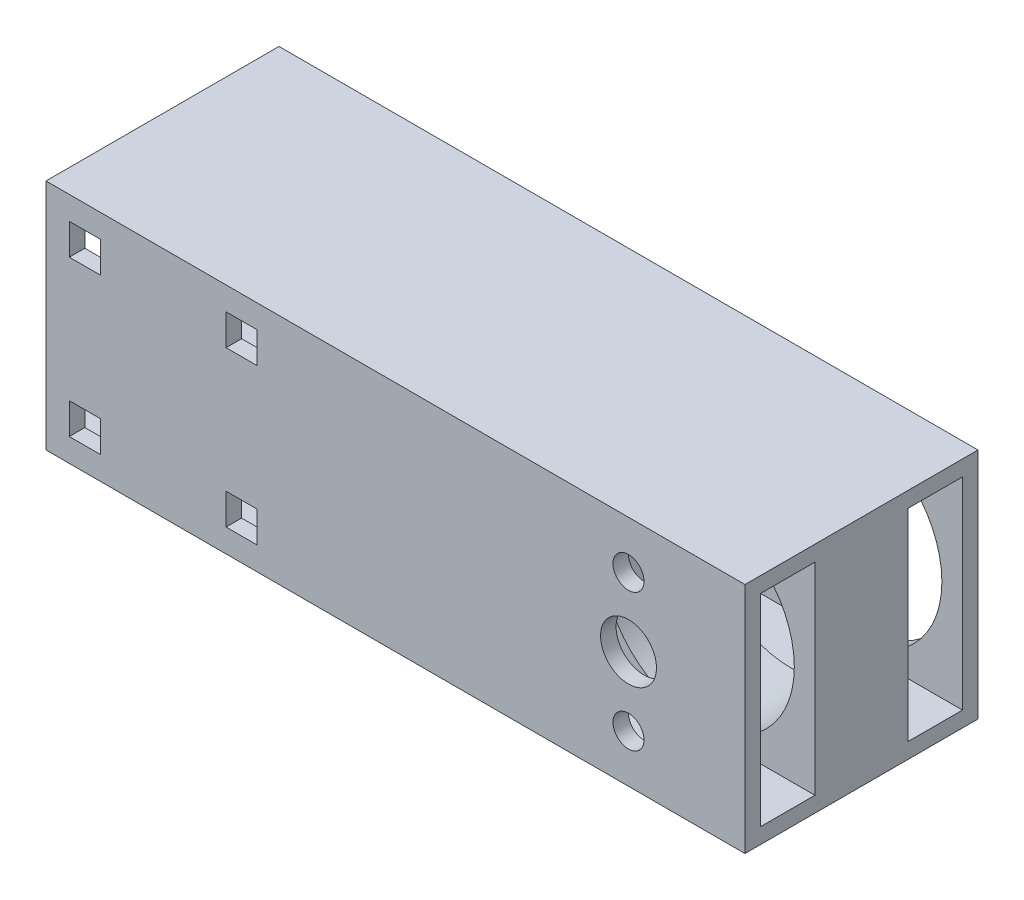
from build123d import *

# Parameters (mm, degrees)
SKETCH1_W           = 30
SKETCH1_H           = 30
SKETCH1_W_2         = 7
SKETCH1_H_2         = 26
BOSS_EXTRUDE3_DEPTH = 90
SKETCH6_R           = 12.35
CUT_EXTRUDE5_DEPTH  = 23
SKETCH8_R           = 3.6
SKETCH8_R_2         = 2
CUT_EXTRUDE6_DEPTH  = 17
SKETCH9_W           = 12
SKETCH9_H           = 26
CUT_EXTRUDE7_DEPTH  = 59
SKETCH10_W          = 4
SKETCH10_H          = 4
CUT_EXTRUDE8_DEPTH  = 34


with BuildPart() as part:
    # Sketch1 → Boss-Extrude3 (new body)
    with BuildSketch(Plane(origin=(0, 0, 0), x_dir=(0, 0, -1), z_dir=(1, 0, 0))):
        Rectangle(SKETCH1_W, SKETCH1_H)
        with Locations((-9.5, 0)):
            Rectangle(SKETCH1_W_2, SKETCH1_H_2, mode=Mode.SUBTRACT)
        with Locations((9.5, 0)):
            Rectangle(SKETCH1_W_2, SKETCH1_H_2, mode=Mode.SUBTRACT)
    extrude(amount=BOSS_EXTRUDE3_DEPTH)

    # Sketch6 → Cut-Extrude5 (cut)
    with BuildSketch(Plane(origin=(0, 0, -15), x_dir=(-1, 0, 0), z_dir=(0, 0, -1))):
        with Locations((-75, 0)):
            Circle(SKETCH6_R)
    extrude(amount=-CUT_EXTRUDE5_DEPTH, mode=Mode.SUBTRACT)

    # Sketch8 → Cut-Extrude6 (cut)
    with BuildSketch(Plane.XY.offset(15)):
        with Locations((75, 0)):
            Circle(SKETCH8_R)
        with Locations((75, 8.85)):
            Circle(SKETCH8_R_2)
        with Locations((75, -8.85)):
            Circle(SKETCH8_R_2)
    extrude(amount=-CUT_EXTRUDE6_DEPTH, mode=Mode.SUBTRACT)

    # Sketch9 → Cut-Extrude7 (cut)
    with BuildSketch(Plane.ZY):
        Rectangle(SKETCH9_W, SKETCH9_H)
    extrude(amount=-CUT_EXTRUDE7_DEPTH, mode=Mode.SUBTRACT)

    # Sketch10 → Cut-Extrude8 (cut)
    with BuildSketch(Plane(origin=(0, 0, -15), x_dir=(-1, 0, 0), z_dir=(0, 0, -1))):
        with Locations((-5, 10)):
            Rectangle(SKETCH10_W, SKETCH10_H)
        with Locations((-25.183834601, 10)):
            Rectangle(SKETCH10_W, SKETCH10_H)
        with Locations((-25.183834601, -10)):
            Rectangle(SKETCH10_W, SKETCH10_H)
        with Locations((-5, -10)):
            Rectangle(SKETCH10_W, SKETCH10_H)
    extrude(amount=-CUT_EXTRUDE8_DEPTH, mode=Mode.SUBTRACT)


solid = part.part
